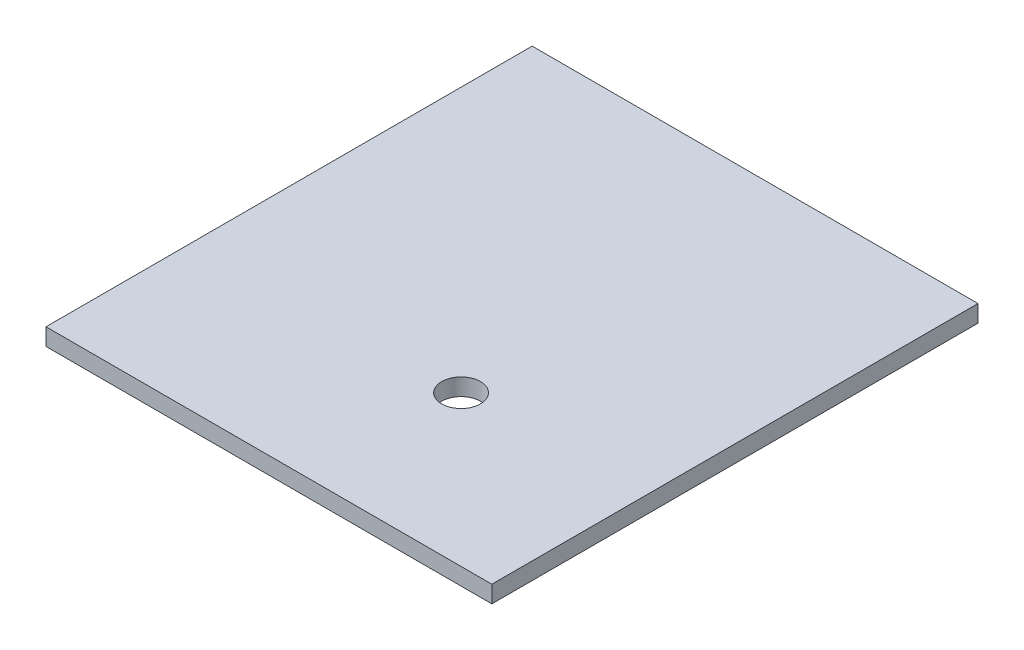
from build123d import *

# Parameters (mm, degrees)
SKETCH1_W           = 146.05
SKETCH1_H           = 159.258
BOSS_EXTRUDE1_DEPTH = 5.588
CUT_EXTRUDE1_REACH  = 110.188
SKETCH4_R           = 6.35


with BuildPart() as part:
    # Sketch1 → Boss-Extrude1 (new body)
    with BuildSketch(Plane(origin=(0, 0, 0), x_dir=(1, 0, 0), z_dir=(0, 1, 0))):
        Rectangle(SKETCH1_W, SKETCH1_H)
    extrude(amount=BOSS_EXTRUDE1_DEPTH)

    # Sketch4 → Cut-Extrude1 (cut, up to next)
    with BuildSketch(Plane(origin=(0, 5.588, 0), x_dir=(1, 0, 0), z_dir=(0, 1, 0)), mode=Mode.PRIVATE) as cut_extrude1_sk1:
        with Locations((13.670647071, -30.353)):
            Circle(SKETCH4_R)
    cut_extrude1_tool1 = extrude(cut_extrude1_sk1.sketch, amount=-CUT_EXTRUDE1_REACH, mode=Mode.PRIVATE) & part.part
    add(cut_extrude1_tool1.solids().sort_by_distance((13.670647, 5.588, 30.353))[0], mode=Mode.SUBTRACT)


solid = part.part
